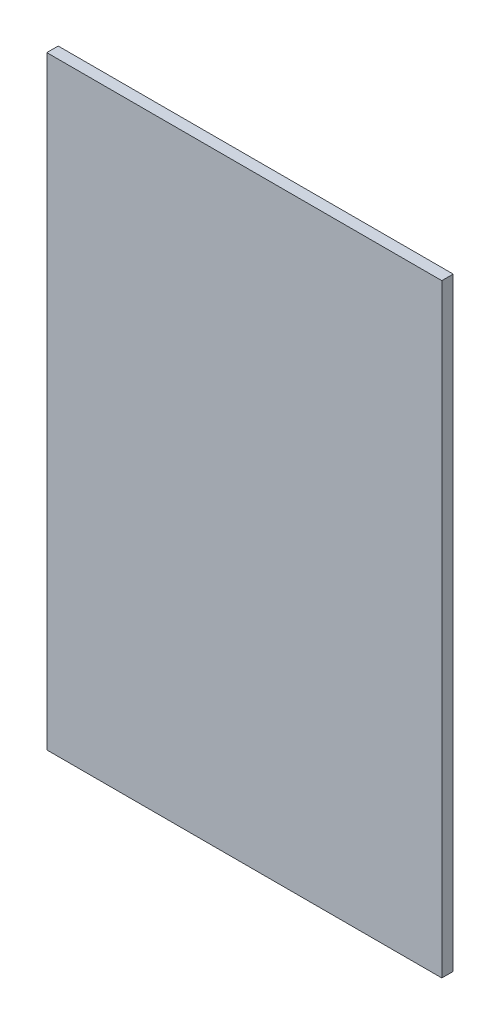
from build123d import *

# Parameters (mm, degrees)
ESQUISSE1_W        = 208
ESQUISSE1_H        = 318
BOSS_EXTRU_1_DEPTH = 6


with BuildPart() as part:
    # Esquisse1 → Boss.-Extru.1 (new body)
    with BuildSketch(Plane.XY):
        with Locations((65.929164598, -116.946226415)):
            Rectangle(ESQUISSE1_W, ESQUISSE1_H)
    extrude(amount=BOSS_EXTRU_1_DEPTH)


solid = part.part
